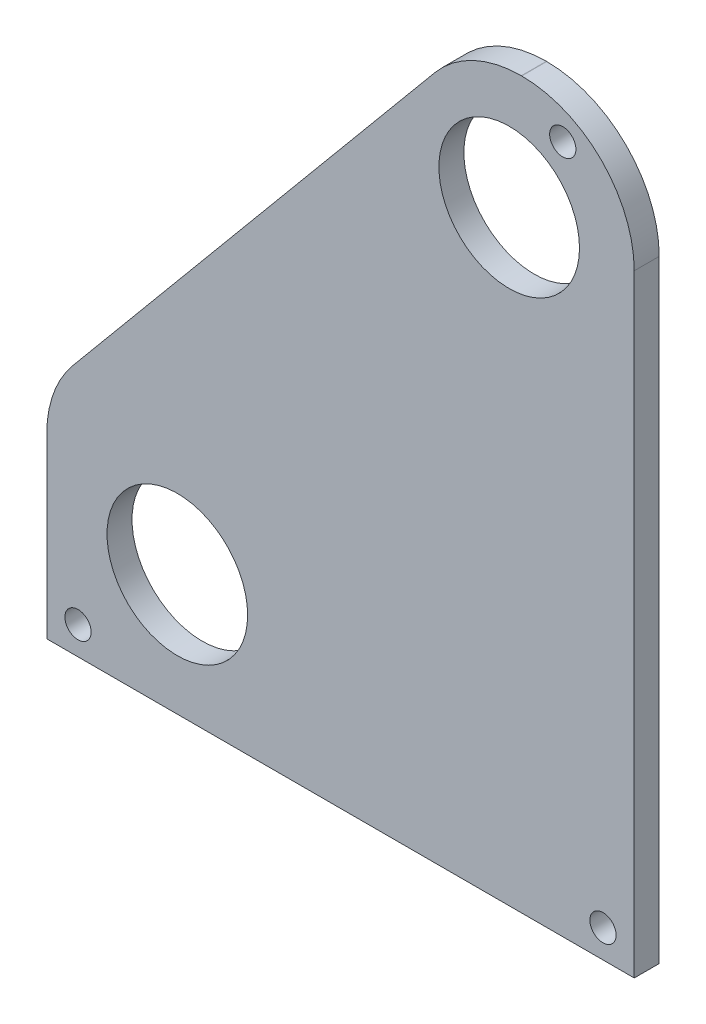
from build123d import *

# Parameters (mm, degrees)
SKETCH1_R           = 14.2875
SKETCH1_R_2         = 2.667
BOSS_EXTRUDE1_DEPTH = 5.08


with BuildPart() as part:
    # Sketch1 → Boss-Extrude1 (new body)
    with BuildSketch(Plane.XY):
        with BuildLine():
            Line((-88.675561218, -72.174799638), (-15.100375475, 16.174480157))
            ThreePointArc((-15.100375475, 16.174480157), (-7.233621561, 22.245820087), (2.465974401, 24.405640421))
            Line((2.465974401, 24.405640421), (2.550788658, 24.405640421))
            ThreePointArc((2.550788658, 24.405640421), (18.715249676, 17.710101439), (25.410788658, 1.545640421))
            Line((25.410788658, 1.545640421), (25.410788658, -122.914359579))
            Line((25.410788658, -122.914359579), (-93.969211342, -122.914359579))
            Line((-93.969211342, -122.914359579), (-93.969211342, -86.803639374))
            ThreePointArc((-93.969211342, -86.803639374), (-92.605098834, -79.02505204), (-88.675561218, -72.174799638))
        make_face()
        Circle(SKETCH1_R, mode=Mode.SUBTRACT)
        with Locations((-67.439052674, -98.331046839)):
            Circle(SKETCH1_R, mode=Mode.SUBTRACT)
        with Locations((10.890976175, 16.991765728)):
            Circle(SKETCH1_R_2, mode=Mode.SUBTRACT)
        with Locations((-87.619211342, -117.235279478)):
            Circle(SKETCH1_R_2, mode=Mode.SUBTRACT)
        with Locations((19.060788658, -117.235279478)):
            Circle(SKETCH1_R_2, mode=Mode.SUBTRACT)
    extrude(amount=BOSS_EXTRUDE1_DEPTH)


solid = part.part
